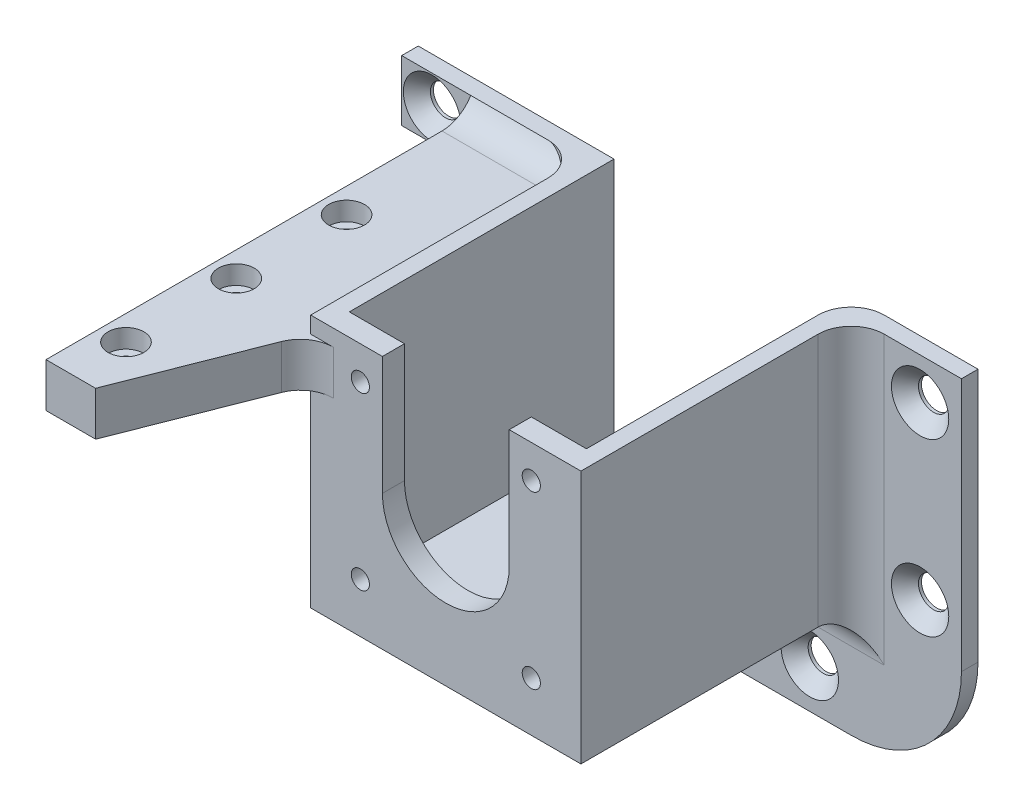
from build123d import *

# Parameters (mm, degrees)
ESQUISSE1_R                                       = 1.65
BOSS_EXTRU_1_DEPTH                                = 2
BOSS_EXTRU_2_DEPTH                                = 48
BOSS_EXTRU_3_DEPTH                                = 3
CONG_1_R                                          = 6
ESQUISSE6_W                                       = 52
ESQUISSE6_H                                       = 8
BOSS_EXTRU_4_DEPTH                                = 20
BOSS_EXTRU_5_DEPTH                                = 8
ESQUISSE8_W                                       = 32.5
ESQUISSE8_H                                       = 11
BOSS_EXTRU_7_DEPTH                                = 3
FRAISAGE_POUR_VIS_T_TE_FRAIS_E_M51_AT_COUNT       = 2
FRAISAGE_POUR_VIS_T_TE_FRAIS_E_M51_AT_PITCH       = 57.584720196
FRAISAGE_POUR_VIS_T_TE_FRAIS_E_M51_2_COUNT        = 2
FRAISAGE_POUR_VIS_T_TE_FRAIS_E_M51_2_PITCH        = 74.276510419
FRAISAGE_POUR_VIS_T_TE_FRAIS_E_M51_3_COUNT        = 2
FRAISAGE_POUR_VIS_T_TE_FRAIS_E_M51_3_PITCH        = 34
FRAISAGE_POUR_VIS_T_TE_FRAIS_E_M51_4_COUNT        = 2
FRAISAGE_POUR_VIS_T_TE_FRAIS_E_M51_4_PITCH        = 63.239623655
CONG_3_R                                          = 6
CONG_4_R                                          = 6
CHAMBRAGE_POUR_VIS_SIX_PANS_CREUX_M31_D           = 3.4
CHAMBRAGE_POUR_VIS_SIX_PANS_CREUX_M31_CBORE_D     = 6.5
CHAMBRAGE_POUR_VIS_SIX_PANS_CREUX_M31_CBORE_DEPTH = 3.4


with BuildPart() as part:
    # Esquisse1 → Boss.-Extru.1 (new, symmetric)
    with BuildSketch(Plane.XY):
        with BuildLine():
            Line((-11.5, 0), (-11.5, 21.5))
            Line((-11.5, 21.5), (-24.5, 21.5))
            Line((-24.5, 21.5), (-24.5, -24.5))
            Line((-24.5, -24.5), (24.5, -24.5))
            Line((24.5, -24.5), (24.5, 21.5))
            Line((24.5, 21.5), (11.5, 21.5))
            Line((11.5, 21.5), (11.5, 0))
            ThreePointArc((11.5, 0), (0, -11.5), (-11.5, 0))
        make_face()
        with Locations((-15.5, 15.5)):
            Circle(ESQUISSE1_R, mode=Mode.SUBTRACT)
        with Locations((15.5, 15.5)):
            Circle(ESQUISSE1_R, mode=Mode.SUBTRACT)
        with Locations((15.5, -15.5)):
            Circle(ESQUISSE1_R, mode=Mode.SUBTRACT)
        with Locations((-15.5, -15.5)):
            Circle(ESQUISSE1_R, mode=Mode.SUBTRACT)
    extrude(amount=BOSS_EXTRU_1_DEPTH, both=True)

    # Esquisse2 → Boss.-Extru.2 (add)
    with BuildSketch(Plane(origin=(0, 0, -2), x_dir=(-1, 0, 0), z_dir=(0, 0, -1))):
        Polygon((-24.5, 21.5), (-21.5, 21.5), (-21.5, -21.5), (21.5, -21.5), (21.5, 21.5), (24.5, 21.5), (24.5, -24.5), (-24.5, -24.5), align=None)
    extrude(amount=BOSS_EXTRU_2_DEPTH)

    # Esquisse4 → Boss.-Extru.3 (add)
    with BuildSketch(Plane(origin=(0, 0, -50), x_dir=(-1, 0, 0), z_dir=(0, 0, -1))):
        with BuildLine():
            Line((-24.5, 21.5), (-44.5, 21.5))
            Line((-44.5, 21.5), (-44.5, -24.5))
            ThreePointArc((-44.5, -24.5), (-38.642135624, -38.642135624), (-24.5, -44.5))
            Line((-24.5, -44.5), (24.5, -44.5))
            Line((24.5, -44.5), (24.5, -24.5))
            Line((24.5, -24.5), (-24.5, -24.5))
            Line((-24.5, -24.5), (-24.5, 21.5))
        make_face()
    extrude(amount=-BOSS_EXTRU_3_DEPTH)

    # Congé1
    cong_1_edges = [part.edges().sort_by_distance(p)[0] for p in [
        (0, -21.5, -50),
        (21.5, 0, -50),
        (24.5, -1.5, -47),
        (0, -24.5, -47),
    ]]
    fillet(cong_1_edges, radius=CONG_1_R)

    # Esquisse6 → Boss.-Extru.4 (add)
    with BuildSketch(Plane.ZY.offset(24.5)):
        with Locations((-24, 14.5)):
            Rectangle(ESQUISSE6_W, ESQUISSE6_H)
    extrude(amount=BOSS_EXTRU_4_DEPTH)

    # Esquisse7 → Boss.-Extru.5 (add)
    with BuildSketch(Plane(origin=(0, 18.5, 0), x_dir=(1, 0, 0), z_dir=(0, 1, 0))):
        Polygon((-44.5, -2), (-44.5, -30), (-35.5, -30), (-24.5, -2), align=None)
    extrude(amount=-BOSS_EXTRU_5_DEPTH)

    # Esquisse8 → Boss.-Extru.7 (add)
    with BuildSketch(Plane(origin=(0, 0, -50), x_dir=(-1, 0, 0), z_dir=(0, 0, -1))):
        with Locations((40.75, 16)):
            Rectangle(ESQUISSE8_W, ESQUISSE8_H)
    extrude(amount=-BOSS_EXTRU_7_DEPTH)

    # Esquisse5 → Fraisage pour vis à tête fraisée M51 (revolve, cut)
    with BuildSketch(Plane(origin=(-17, -37, -47), x_dir=(0, -1, 0), z_dir=(1, 0, 0))):
        Polygon((0, 0), (0, 3), (2.75, 3), (2.75, 2.45), (5.2, 0), align=None)
    fraisage_pour_vis_t_te_frais_e_m51 = revolve(axis=Axis((-17, -37, -40.65), (0, 0, -1)), mode=Mode.SUBTRACT)

    # Fraisage pour vis à tête fraisée M51 at: Fraisage pour vis à tête fraisée M51 ×2
    with Locations(*[Vector(0.9377487607237037, 0.3473143558235938, 0) * (i * FRAISAGE_POUR_VIS_T_TE_FRAIS_E_M51_AT_PITCH) for i in range(1, FRAISAGE_POUR_VIS_T_TE_FRAIS_E_M51_AT_COUNT)]):
        add(fraisage_pour_vis_t_te_frais_e_m51, mode=Mode.SUBTRACT)

    # Fraisage pour vis _ t_te frais_e M51 2: Fraisage pour vis à tête fraisée M51 ×2
    with Locations(*[Vector(0.7270131525498176, 0.6866235329637164, 0) * (i * FRAISAGE_POUR_VIS_T_TE_FRAIS_E_M51_2_PITCH) for i in range(1, FRAISAGE_POUR_VIS_T_TE_FRAIS_E_M51_2_COUNT)]):
        add(fraisage_pour_vis_t_te_frais_e_m51, mode=Mode.SUBTRACT)

    # Fraisage pour vis _ t_te frais_e M51 3: Fraisage pour vis à tête fraisée M51 ×2
    with Locations(*[(i * FRAISAGE_POUR_VIS_T_TE_FRAIS_E_M51_3_PITCH, 0, 0) for i in range(1, FRAISAGE_POUR_VIS_T_TE_FRAIS_E_M51_3_COUNT)]):
        add(fraisage_pour_vis_t_te_frais_e_m51, mode=Mode.SUBTRACT)

    # Fraisage pour vis _ t_te frais_e M51 4: Fraisage pour vis à tête fraisée M51 ×2
    with Locations(*[Vector(-0.5455440435307616, 0.8380821538298656, 0) * (i * FRAISAGE_POUR_VIS_T_TE_FRAIS_E_M51_4_PITCH) for i in range(1, FRAISAGE_POUR_VIS_T_TE_FRAIS_E_M51_4_COUNT)]):
        add(fraisage_pour_vis_t_te_frais_e_m51, mode=Mode.SUBTRACT)

    # Congé3
    # the kernel refuses this fillet: 6 mm, written as the material it adds along each edge
    with BuildSketch(Plane(origin=(-44.5, 18.5, -47), x_dir=(0, 0, 1), z_dir=(1, 0, 0))) as cong_3_piece_1_section:
        with BuildLine():
            CenterArc((5.196152423, -6), CONG_3_R, 90, 60)
            Line((0, -3), (0, 0))
            Line((0, 0), (5.196152423, 0))
        make_face()
    cong_3_piece_1 = extrude(amount=32.990381057, mode=Mode.PRIVATE)
    cong_3_piece_1 = split(cong_3_piece_1, bisect_by=Plane(origin=(-21.5, 18.653513823, -43.204827013), z_dir=(-1, 0, 0)), keep=Keep.TOP, mode=Mode.PRIVATE)
    add(cong_3_piece_1)
    with BuildSketch(Plane(origin=(-24.5, 18.5, -47), x_dir=(0, 0, 1), z_dir=(0, 1, 0))) as cong_3_piece_2:
        with BuildLine():
            CenterArc((CONG_3_R, -CONG_3_R), CONG_3_R, 90, 90)
            Line((0, -CONG_3_R), (0, 0))
            Line((0, 0), (CONG_3_R, 0))
        make_face()
    extrude(amount=3)

    # Congé4
    cong_4_edges = [part.edges().sort_by_distance(p)[0] for p in [
        (-24.5, 14.5, 2),
    ]]
    fillet(cong_4_edges, radius=CONG_4_R)

    # Chambrage pour vis à six pans creux M31 (through all)
    with Locations(Plane(origin=(-40, 18.5, -20), x_dir=(0, 0, 1), z_dir=(0, 1, 0))):
        with Locations((0, 0), (20, 0), (40, 0)):
            CounterBoreHole(CHAMBRAGE_POUR_VIS_SIX_PANS_CREUX_M31_D / 2, CHAMBRAGE_POUR_VIS_SIX_PANS_CREUX_M31_CBORE_D / 2, CHAMBRAGE_POUR_VIS_SIX_PANS_CREUX_M31_CBORE_DEPTH)


solid = part.part
